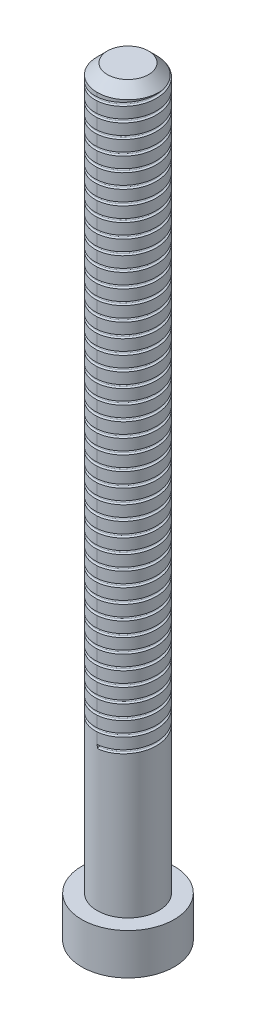
from build123d import *

# Parameters (mm, degrees)
SKETCH1_R              = 2.25
BOSS_EXTRUDE1_DEPTH    = 37
SKETCH2_OUTSIDE_W      = 14.008
SKETCH2_OUTSIDE_H      = 14.008
SKETCH2_OUTSIDE_R      = 1.5
CUT_EXTRUDE1_DEPTH     = 35
CHAMFER1_SIZE          = 0.5
CUT_SWEEP1_PITCH       = 0.7
CUT_SWEEP1_HEIGHT      = 28
CUT_SWEEP1_RADIUS      = 1.5
CUT_SWEEP1_START_ANGLE = 180
CUT_EXTRUDE2_DEPTH     = 1.5


with BuildPart() as part:
    # Sketch1 → Boss-Extrude1 (new body)
    with BuildSketch(Plane(origin=(0, 0, 0), x_dir=(1, 0, 0), z_dir=(0, 1, 0))):
        with Locations(Location((0, 0, 0), (0, 0, 270))):
            Circle(SKETCH1_R)
    extrude(amount=BOSS_EXTRUDE1_DEPTH)

    # Sketch2 outside → Cut-Extrude1 (cut)
    with BuildSketch(Plane(origin=(0, 37, 0), x_dir=(1, 0, 0), z_dir=(0, 1, 0))):
        Rectangle(SKETCH2_OUTSIDE_W, SKETCH2_OUTSIDE_H)
        with Locations(Location((0, 0, 0), (0, 0, 270))):
            Circle(SKETCH2_OUTSIDE_R, mode=Mode.SUBTRACT)
    extrude(amount=-CUT_EXTRUDE1_DEPTH, mode=Mode.SUBTRACT)

    # Chamfer1
    chamfer1_edges = [part.edges().sort_by_distance(p)[0] for p in [
        (0, 37, -1.5),
    ]]
    chamfer(chamfer1_edges, length=CHAMFER1_SIZE)

    # Cut-Sweep1: sweep along a helix
    with BuildLine() as cut_sweep1_path:
        add(Helix(CUT_SWEEP1_PITCH, CUT_SWEEP1_HEIGHT, CUT_SWEEP1_RADIUS, center=(0, 37, 0), direction=(0, -1, 0), mode=Mode.PRIVATE).rotate(Axis((0, 37, 0), (0, -1, 0)), CUT_SWEEP1_START_ANGLE))
    # Sketch7 → Cut-Sweep1 (sweep, cut)
    with BuildSketch(Plane(origin=(0, 37, 1.5), x_dir=(0, 0, 1), z_dir=(-0.9972531714167715, -0.07406829348102623, 0))):
        with BuildLine():
            Line((-0.081023547, -0.030253267), (0.549038106, 0.274742329))
            Line((0.549038106, 0.274742329), (0.549038106, -0.425257671))
            Line((0.549038106, -0.425257671), (-0.081023547, -0.120262075))
            ThreePointArc((-0.081023547, -0.120262075), (-0.109238147, -0.075257671), (-0.081023547, -0.030253267))
        make_face()
    sweep(path=cut_sweep1_path.line, is_frenet=True, mode=Mode.SUBTRACT)

    # Sketch8 → Cut-Extrude2 (cut)
    with BuildSketch(Plane.XZ):
        Polygon((1.154700538, 0), (0.577350269, 1), (-0.577350269, 1), (-1.154700538, 0), (-0.577350269, -1), (0.577350269, -1), align=None)
    extrude(amount=-CUT_EXTRUDE2_DEPTH, mode=Mode.SUBTRACT)


solid = part.part
